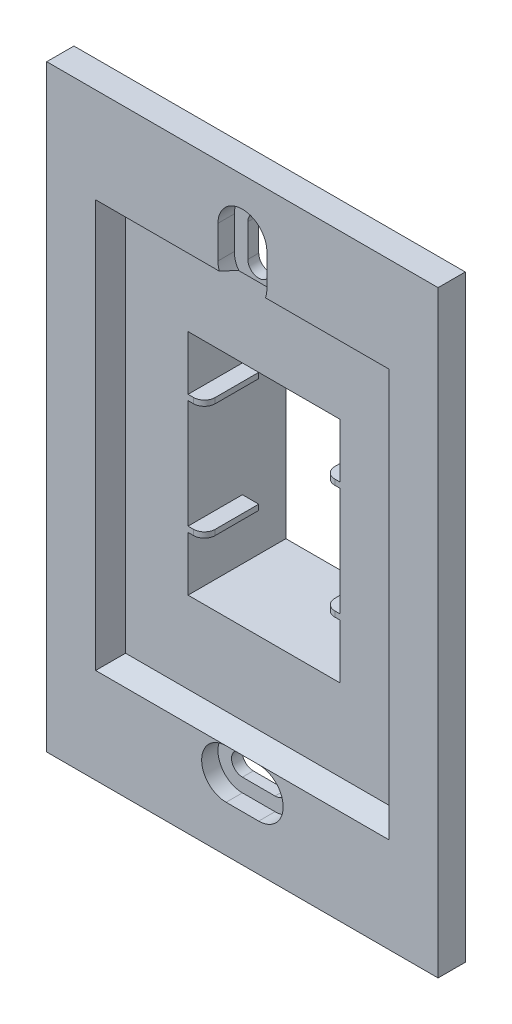
from build123d import *

# Parameters (mm, degrees)
ESBO_O1_W                = 72
ESBO_O1_H                = 110
RESSALTO_EXTRUS_O1_DEPTH = 5
ESBO_O2_W                = 51
ESBO_O2_H                = 72
CORTE_EXTRUS_O1_DEPTH    = 4
CHANFRO1_SIZE            = 1.5
CHANFRO1_SIZE_2          = 4
CORTE_EXTRUS_O2_DEPTH    = 66.924198895
CORTE_EXTRUS_O3_DEPTH    = 66.924198895
CORTE_EXTRUS_O4_DEPTH    = 3
CORTE_EXTRUS_O5_DEPTH    = 3
ESBO_O7_W                = 31
ESBO_O7_H                = 44
RESSALTO_EXTRUS_O2_DEPTH = 17
ESBO_O8_W                = 28
ESBO_O8_H                = 42
CORTE_EXTRUS_O6_DEPTH    = 70.318107302
ESBO_O9_W                = 3
ESBO_O9_H                = 1
RESSALTO_EXTRUS_O3_DEPTH = 10
FILETE1_R                = 2


with BuildPart() as part:
    # Esboço1 → Ressalto-extrusão1 (new body)
    with BuildSketch(Plane.XY):
        Rectangle(ESBO_O1_W, ESBO_O1_H)
    extrude(amount=RESSALTO_EXTRUS_O1_DEPTH)

    # Esboço2 → Corte-extrusão1 (cut)
    with BuildSketch(Plane.XY.offset(5)):
        Rectangle(ESBO_O2_W, ESBO_O2_H)
    extrude(amount=-CORTE_EXTRUS_O1_DEPTH, mode=Mode.SUBTRACT)

    # Chanfro1
    # the kernel refuses this chamfer: 4, 1.5 mm, written as the material it takes off along each edge
    with BuildSketch(Plane(origin=(-25.5, -36, 5), x_dir=(0, -0.9953980532473654, 0.09582648689874358), z_dir=(1, 0, 0))) as chanfro1_piece_1_section:
        Polygon((CHANFRO1_SIZE * 0.995398053247, CHANFRO1_SIZE * 0.0958264868987), (-CHANFRO1_SIZE_2 * 0.0958264868987, CHANFRO1_SIZE_2 * 0.995398053247), (0, 0), align=None)
    chanfro1_piece_1 = extrude(amount=51, mode=Mode.PRIVATE)
    chanfro1_piece_1 = split(chanfro1_piece_1, bisect_by=Plane(origin=(0, -36.465264147, 1), z_dir=(0, 0, 1)), keep=Keep.TOP, mode=Mode.PRIVATE)
    add(chanfro1_piece_1, mode=Mode.SUBTRACT)
    with BuildSketch(Plane(origin=(-25.5, 36, 5), x_dir=(-0.9953980532473654, 0, 0.09582648689874379), z_dir=(0, -1, 0))) as chanfro1_piece_2_section:
        Polygon((CHANFRO1_SIZE * 0.995398053247, CHANFRO1_SIZE * 0.0958264868987), (-CHANFRO1_SIZE_2 * 0.0958264868987, CHANFRO1_SIZE_2 * 0.995398053247), (0, 0), align=None)
    chanfro1_piece_2 = extrude(amount=72, mode=Mode.PRIVATE)
    chanfro1_piece_2 = split(chanfro1_piece_2, bisect_by=Plane(origin=(-25.965264147, 0, 1), z_dir=(0, 0, 1)), keep=Keep.TOP, mode=Mode.PRIVATE)
    add(chanfro1_piece_2, mode=Mode.SUBTRACT)
    with BuildSketch(Plane(origin=(25.5, -36, 5), x_dir=(0.9953980532473654, 0, 0.09582648689874379), z_dir=(0, 1, 0))) as chanfro1_piece_3_section:
        Polygon((CHANFRO1_SIZE * 0.995398053247, CHANFRO1_SIZE * 0.0958264868987), (-CHANFRO1_SIZE_2 * 0.0958264868987, CHANFRO1_SIZE_2 * 0.995398053247), (0, 0), align=None)
    chanfro1_piece_3 = extrude(amount=72, mode=Mode.PRIVATE)
    chanfro1_piece_3 = split(chanfro1_piece_3, bisect_by=Plane(origin=(25.965264147, 0, 1), z_dir=(0, 0, 1)), keep=Keep.TOP, mode=Mode.PRIVATE)
    add(chanfro1_piece_3, mode=Mode.SUBTRACT)
    with BuildSketch(Plane(origin=(25.5, 36, 5), x_dir=(0, 0.9953980532473654, 0.09582648689874358), z_dir=(-1, 0, 0))) as chanfro1_piece_4_section:
        Polygon((CHANFRO1_SIZE * 0.995398053247, CHANFRO1_SIZE * 0.0958264868987), (-CHANFRO1_SIZE_2 * 0.0958264868987, CHANFRO1_SIZE_2 * 0.995398053247), (0, 0), align=None)
    chanfro1_piece_4 = extrude(amount=51, mode=Mode.PRIVATE)
    chanfro1_piece_4 = split(chanfro1_piece_4, bisect_by=Plane(origin=(0, 36.465264147, 1), z_dir=(0, 0, 1)), keep=Keep.TOP, mode=Mode.PRIVATE)
    add(chanfro1_piece_4, mode=Mode.SUBTRACT)
    with BuildSketch(Plane(origin=(-35.875482322, -36, 5), x_dir=(0, -0.9953980532473654, 0.09582648689874358), z_dir=(1, 0, 0))) as chanfro1_piece_5a_section:
        Polygon((CHANFRO1_SIZE * 0.995398053247, CHANFRO1_SIZE * 0.0958264868987), (-CHANFRO1_SIZE_2 * 0.0958264868987, CHANFRO1_SIZE_2 * 0.995398053247), (0, 0), align=None)
    chanfro1_piece_5a = extrude(amount=61.375482322, mode=Mode.PRIVATE)
    chanfro1_piece_5a = split(chanfro1_piece_5a, bisect_by=Plane(origin=(-25.5, -36.465264147, 3.645492171), z_dir=(-1, 0, 0)), keep=Keep.TOP, mode=Mode.PRIVATE)
    chanfro1_piece_5a = split(chanfro1_piece_5a, bisect_by=Plane(origin=(-30.687741161, -36.465264147, 1), z_dir=(0, 0, 1)), keep=Keep.TOP, mode=Mode.PRIVATE)
    with BuildSketch(Plane(origin=(-25.5, 36, 5), x_dir=(-0.9953980532473654, 0, 0.09582648689874379), z_dir=(0, -1, 0))) as chanfro1_piece_5b_section:
        Polygon((CHANFRO1_SIZE * 0.995398053247, CHANFRO1_SIZE * 0.0958264868987), (-CHANFRO1_SIZE_2 * 0.0958264868987, CHANFRO1_SIZE_2 * 0.995398053247), (0, 0), align=None)
    chanfro1_piece_5b = extrude(amount=82.375482322, mode=Mode.PRIVATE)
    chanfro1_piece_5b = split(chanfro1_piece_5b, bisect_by=Plane(origin=(-25.965264147, -36, 3.645492171), z_dir=(0, -1, 0)), keep=Keep.TOP, mode=Mode.PRIVATE)
    chanfro1_piece_5b = split(chanfro1_piece_5b, bisect_by=Plane(origin=(-25.965264147, -41.187741161, 1), z_dir=(0, 0, 1)), keep=Keep.TOP, mode=Mode.PRIVATE)
    chanfro1_piece_5 = chanfro1_piece_5a & chanfro1_piece_5b
    add(chanfro1_piece_5, mode=Mode.SUBTRACT)
    with BuildSketch(Plane(origin=(-25.5, -36, 5), x_dir=(0, -0.9953980532473654, 0.09582648689874358), z_dir=(1, 0, 0))) as chanfro1_piece_6a_section:
        Polygon((CHANFRO1_SIZE * 0.995398053247, CHANFRO1_SIZE * 0.0958264868987), (-CHANFRO1_SIZE_2 * 0.0958264868987, CHANFRO1_SIZE_2 * 0.995398053247), (0, 0), align=None)
    chanfro1_piece_6a = extrude(amount=61.375482322, mode=Mode.PRIVATE)
    chanfro1_piece_6a = split(chanfro1_piece_6a, bisect_by=Plane(origin=(25.5, -36.465264147, 3.645492171), z_dir=(1, 0, 0)), keep=Keep.TOP, mode=Mode.PRIVATE)
    chanfro1_piece_6a = split(chanfro1_piece_6a, bisect_by=Plane(origin=(30.687741161, -36.465264147, 1), z_dir=(0, 0, 1)), keep=Keep.TOP, mode=Mode.PRIVATE)
    with BuildSketch(Plane(origin=(25.5, -46.375482322, 5), x_dir=(0.9953980532473654, 0, 0.09582648689874379), z_dir=(0, 1, 0))) as chanfro1_piece_6b_section:
        Polygon((CHANFRO1_SIZE * 0.995398053247, CHANFRO1_SIZE * 0.0958264868987), (-CHANFRO1_SIZE_2 * 0.0958264868987, CHANFRO1_SIZE_2 * 0.995398053247), (0, 0), align=None)
    chanfro1_piece_6b = extrude(amount=82.375482322, mode=Mode.PRIVATE)
    chanfro1_piece_6b = split(chanfro1_piece_6b, bisect_by=Plane(origin=(25.965264147, -36, 3.645492171), z_dir=(0, -1, 0)), keep=Keep.TOP, mode=Mode.PRIVATE)
    chanfro1_piece_6b = split(chanfro1_piece_6b, bisect_by=Plane(origin=(25.965264147, -41.187741161, 1), z_dir=(0, 0, 1)), keep=Keep.TOP, mode=Mode.PRIVATE)
    chanfro1_piece_6 = chanfro1_piece_6a & chanfro1_piece_6b
    add(chanfro1_piece_6, mode=Mode.SUBTRACT)
    with BuildSketch(Plane(origin=(25.5, 36, 5), x_dir=(0, 0.9953980532473654, 0.09582648689874358), z_dir=(-1, 0, 0))) as chanfro1_piece_7a_section:
        Polygon((CHANFRO1_SIZE * 0.995398053247, CHANFRO1_SIZE * 0.0958264868987), (-CHANFRO1_SIZE_2 * 0.0958264868987, CHANFRO1_SIZE_2 * 0.995398053247), (0, 0), align=None)
    chanfro1_piece_7a = extrude(amount=61.375482322, mode=Mode.PRIVATE)
    chanfro1_piece_7a = split(chanfro1_piece_7a, bisect_by=Plane(origin=(-25.5, 36.465264147, 3.645492171), z_dir=(-1, 0, 0)), keep=Keep.TOP, mode=Mode.PRIVATE)
    chanfro1_piece_7a = split(chanfro1_piece_7a, bisect_by=Plane(origin=(-30.687741161, 36.465264147, 1), z_dir=(0, 0, 1)), keep=Keep.TOP, mode=Mode.PRIVATE)
    with BuildSketch(Plane(origin=(-25.5, 46.375482322, 5), x_dir=(-0.9953980532473654, 0, 0.09582648689874379), z_dir=(0, -1, 0))) as chanfro1_piece_7b_section:
        Polygon((CHANFRO1_SIZE * 0.995398053247, CHANFRO1_SIZE * 0.0958264868987), (-CHANFRO1_SIZE_2 * 0.0958264868987, CHANFRO1_SIZE_2 * 0.995398053247), (0, 0), align=None)
    chanfro1_piece_7b = extrude(amount=82.375482322, mode=Mode.PRIVATE)
    chanfro1_piece_7b = split(chanfro1_piece_7b, bisect_by=Plane(origin=(-25.965264147, 36, 3.645492171), z_dir=(0, 1, 0)), keep=Keep.TOP, mode=Mode.PRIVATE)
    chanfro1_piece_7b = split(chanfro1_piece_7b, bisect_by=Plane(origin=(-25.965264147, 41.187741161, 1), z_dir=(0, 0, 1)), keep=Keep.TOP, mode=Mode.PRIVATE)
    chanfro1_piece_7 = chanfro1_piece_7a & chanfro1_piece_7b
    add(chanfro1_piece_7, mode=Mode.SUBTRACT)
    with BuildSketch(Plane(origin=(25.5, -36, 5), x_dir=(0.9953980532473654, 0, 0.09582648689874379), z_dir=(0, 1, 0))) as chanfro1_piece_8a_section:
        Polygon((CHANFRO1_SIZE * 0.995398053247, CHANFRO1_SIZE * 0.0958264868987), (-CHANFRO1_SIZE_2 * 0.0958264868987, CHANFRO1_SIZE_2 * 0.995398053247), (0, 0), align=None)
    chanfro1_piece_8a = extrude(amount=82.375482322, mode=Mode.PRIVATE)
    chanfro1_piece_8a = split(chanfro1_piece_8a, bisect_by=Plane(origin=(25.965264147, 36, 3.645492171), z_dir=(0, 1, 0)), keep=Keep.TOP, mode=Mode.PRIVATE)
    chanfro1_piece_8a = split(chanfro1_piece_8a, bisect_by=Plane(origin=(25.965264147, 41.187741161, 1), z_dir=(0, 0, 1)), keep=Keep.TOP, mode=Mode.PRIVATE)
    with BuildSketch(Plane(origin=(35.875482322, 36, 5), x_dir=(0, 0.9953980532473654, 0.09582648689874358), z_dir=(-1, 0, 0))) as chanfro1_piece_8b_section:
        Polygon((CHANFRO1_SIZE * 0.995398053247, CHANFRO1_SIZE * 0.0958264868987), (-CHANFRO1_SIZE_2 * 0.0958264868987, CHANFRO1_SIZE_2 * 0.995398053247), (0, 0), align=None)
    chanfro1_piece_8b = extrude(amount=61.375482322, mode=Mode.PRIVATE)
    chanfro1_piece_8b = split(chanfro1_piece_8b, bisect_by=Plane(origin=(25.5, 36.465264147, 3.645492171), z_dir=(1, 0, 0)), keep=Keep.TOP, mode=Mode.PRIVATE)
    chanfro1_piece_8b = split(chanfro1_piece_8b, bisect_by=Plane(origin=(30.687741161, 36.465264147, 1), z_dir=(0, 0, 1)), keep=Keep.TOP, mode=Mode.PRIVATE)
    chanfro1_piece_8 = chanfro1_piece_8a & chanfro1_piece_8b
    add(chanfro1_piece_8, mode=Mode.SUBTRACT)

    # Esboço3 → Corte-extrusão2 (cut, through all)
    with BuildSketch(Plane.XY.offset(5)):
        with BuildLine():
            Line((-2, 45), (-2, 39))
            ThreePointArc((-2, 39), (0, 37), (2, 39))
            Line((2, 39), (2, 45))
            ThreePointArc((2, 45), (0, 47), (-2, 45))
        make_face()
    extrude(amount=-CORTE_EXTRUS_O2_DEPTH, mode=Mode.SUBTRACT)

    # Esboço4 → Corte-extrusão3 (cut, through all)
    with BuildSketch(Plane.XY.offset(5)):
        with BuildLine():
            Line((-3, -40), (3, -40))
            ThreePointArc((3, -40), (5, -42), (3, -44))
            Line((3, -44), (-3, -44))
            ThreePointArc((-3, -44), (-5, -42), (-3, -40))
        make_face()
    extrude(amount=-CORTE_EXTRUS_O3_DEPTH, mode=Mode.SUBTRACT)

    # Esboço5 → Corte-extrusão4 (cut)
    with BuildSketch(Plane.XY.offset(5)):
        with BuildLine():
            Line((4.5, 39), (4.5, 45))
            ThreePointArc((4.5, 45), (0, 49.5), (-4.5, 45))
            Line((-4.5, 45), (-4.5, 39))
            ThreePointArc((-4.5, 39), (-4.101470225, 37.148529775), (-2.976470225, 35.625))
            ThreePointArc((-2.976470225, 35.625), (0, 34.5), (2.976470225, 35.625))
            ThreePointArc((2.976470225, 35.625), (4.101470225, 37.148529775), (4.5, 39))
        make_face()
    extrude(amount=-CORTE_EXTRUS_O4_DEPTH, mode=Mode.SUBTRACT)

    # Esboço6 → Corte-extrusão5 (cut)
    with BuildSketch(Plane.XY.offset(5)):
        with BuildLine():
            Line((-3, -46.5), (3, -46.5))
            ThreePointArc((3, -46.5), (7.5, -42), (3, -37.5))
            Line((3, -37.5), (-3, -37.5))
            ThreePointArc((-3, -37.5), (-7.5, -42), (-3, -46.5))
        make_face()
    extrude(amount=-CORTE_EXTRUS_O5_DEPTH, mode=Mode.SUBTRACT)

    # Esboço7 → Ressalto-extrusão2 (add)
    with BuildSketch(Plane(origin=(0, 0, 0), x_dir=(-1, 0, 0), z_dir=(0, 0, -1))):
        Rectangle(ESBO_O7_W, ESBO_O7_H)
    extrude(amount=RESSALTO_EXTRUS_O2_DEPTH)

    # Esboço8 → Corte-extrusão6 (cut, through all)
    with BuildSketch(Plane(origin=(0, 0, -17), x_dir=(-1, 0, 0), z_dir=(0, 0, -1))):
        Rectangle(ESBO_O8_W, ESBO_O8_H)
    extrude(amount=-CORTE_EXTRUS_O6_DEPTH, mode=Mode.SUBTRACT)

    # Esboço9 → Ressalto-extrusão3 (add)
    with BuildSketch(Plane.XY.offset(1)):
        with Locations((-12.5, 10.5)):
            Rectangle(ESBO_O9_W, ESBO_O9_H)
        with Locations((12.5, 10.5)):
            Rectangle(ESBO_O9_W, ESBO_O9_H)
        with Locations((12.5, -10.5)):
            Rectangle(ESBO_O9_W, ESBO_O9_H)
        with Locations((-12.5, -10.5)):
            Rectangle(ESBO_O9_W, ESBO_O9_H)
    extrude(amount=-RESSALTO_EXTRUS_O3_DEPTH)

    # Filete1
    filete1_edges = [part.edges().sort_by_distance(p)[0] for p in [
        (-11, 10.5, 1),
        (11, 10.5, 1),
        (11, -10.5, 1),
        (-11, -10.5, 1),
    ]]
    fillet(filete1_edges, radius=FILETE1_R)


solid = part.part
